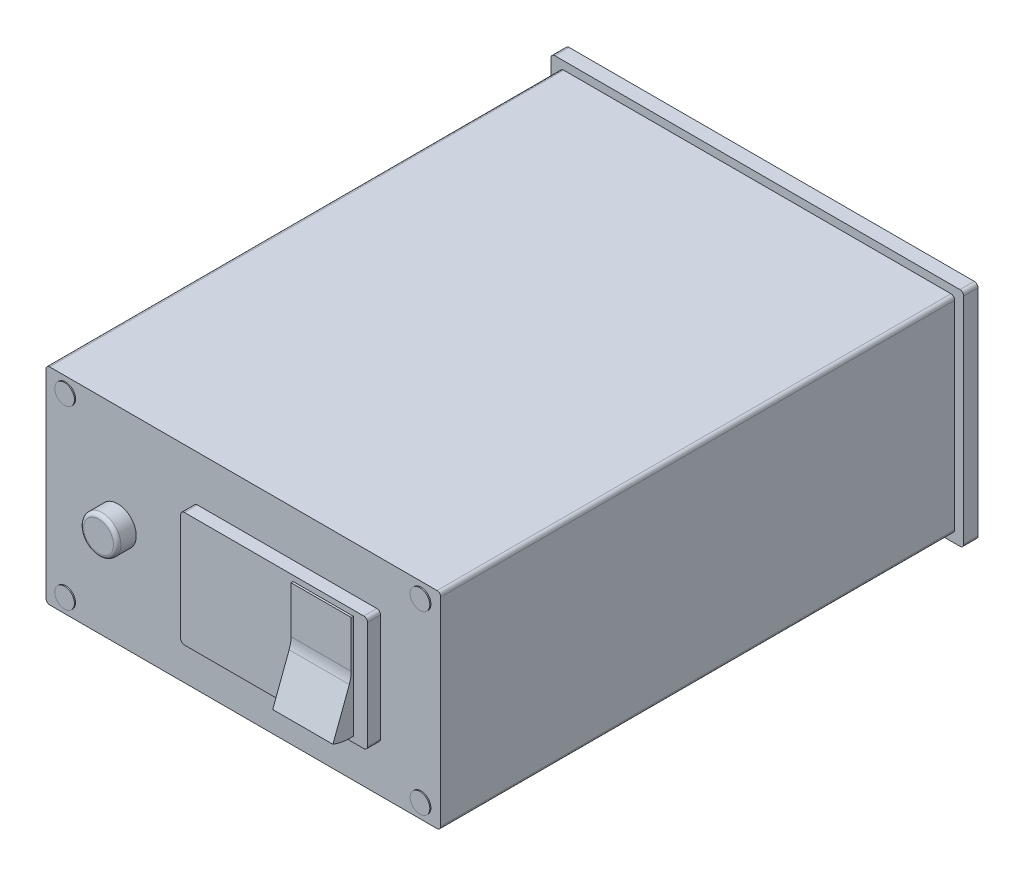
from build123d import *

# Parameters (mm, degrees)
SKETCH1_W               = 111.06
SKETCH1_H               = 59.85
FACE_2_DEPTH            = 3.86
FACE_FILLETS_R          = 1
SKETCH2_W               = 106.25
SKETCH2_H               = 55.5
BODY_DEPTH              = 142.2
SKETCH3_W               = 12.75
SKETCH3_H               = 12.75
FEET_DEPTH              = 3.33
FEET_DRAFT              = 25
FEET_PROFILE_2_DEPTH    = 3.33
FEET_PROFILE_2_DRAFT    = 25
FEET_PROFILE_3_DEPTH    = 3.33
FEET_PROFILE_3_DRAFT    = 25
FEET_PROFILE_4_DEPTH    = 3.33
FEET_PROFILE_4_DRAFT    = 25
BODY_FILLETS_R          = 1
SKETCH4_R               = 5
GND_BANNANA_PORT_DEPTH  = 5.15
FILLET3_R               = 1
SKETCH5_W               = 50.3
SKETCH5_H               = 30.9
POWER_PORT_DEPTH        = 3.5
FILLET4_R               = 1
BOSS_EXTRUDE6_DEPTH     = 8.1
SKETCH7_R               = 6.5
BOSS_EXTRUDE7_DEPTH     = 2.35
SKETCH8_R               = 2.65
BOSS_EXTRUDE8_DEPTH     = 0.3
MIRROR2_COPY_1_SKETCH_R = 2.65
MIRROR2_COPY_1_DEPTH    = 0.3
MIRROR2_COPY_2_SKETCH_R = 2.65
MIRROR2_COPY_2_DEPTH    = 0.3


with BuildPart() as part:
    # Sketch1 → Face 2 (new body)
    with BuildSketch(Plane.XY):
        Rectangle(SKETCH1_W, SKETCH1_H)
    extrude(amount=FACE_2_DEPTH)

    # Face Fillets
    face_fillets_edges = [part.edges().sort_by_distance(p)[0] for p in [
        (-55.53, 29.925, 1.93),
        (-55.53, -29.925, 1.93),
        (55.53, -29.925, 1.93),
        (55.53, 29.925, 1.93),
    ]]
    fillet(face_fillets_edges, radius=FACE_FILLETS_R)

    # Sketch2 → Body (add)
    with BuildSketch(Plane.XY):
        Rectangle(SKETCH2_W, SKETCH2_H)
    extrude(amount=BODY_DEPTH)


with BuildPart() as feet_tool:
    # Sketch3 → Feet (with draft: the straight prism first)
    with BuildSketch(Plane.XZ.offset(27.75)):
        with Locations((-36.625, 123.95)):
            Rectangle(SKETCH3_W, SKETCH3_H)
    extrude(amount=FEET_DEPTH)
    # Feet: the draft: its side faces are tilted about the plane it starts from
    feet_sides = [feet_tool.faces().sort_by_distance(p)[0] for p in [
        (-36.625, -29.415, 117.575),
        (-30.25, -29.415, 123.95),
        (-36.625, -29.415, 130.325),
        (-43, -29.415, 123.95),
    ]]
    draft(feet_sides, Plane.XZ.offset(27.75), FEET_DRAFT)


with BuildPart() as part_1:
    add(part.part)

    # Feet: add feet_tool
    add(feet_tool.part)


with BuildPart() as feet_profile_2_tool:
    # Sketch3 → Feet profile 2 (with draft: the straight prism first)
    with BuildSketch(Plane.XZ.offset(27.75)):
        with Locations((36.625, 123.95)):
            Rectangle(SKETCH3_W, SKETCH3_H)
    extrude(amount=FEET_PROFILE_2_DEPTH)
    # Feet profile 2: the draft: its side faces are tilted about the plane it starts from
    feet_profile_2_sides = [feet_profile_2_tool.faces().sort_by_distance(p)[0] for p in [
        (36.625, -29.415, 117.575),
        (43, -29.415, 123.95),
        (36.625, -29.415, 130.325),
        (30.25, -29.415, 123.95),
    ]]
    draft(feet_profile_2_sides, Plane.XZ.offset(27.75), FEET_PROFILE_2_DRAFT)


with BuildPart() as part_2:
    add(part_1.part)

    # Feet profile 2: add feet_profile_2_tool
    add(feet_profile_2_tool.part)


with BuildPart() as feet_profile_3_tool:
    # Sketch3 → Feet profile 3 (with draft: the straight prism first)
    with BuildSketch(Plane.XZ.offset(27.75)):
        with Locations((36.625, 18.86)):
            Rectangle(SKETCH3_W, SKETCH3_H)
    extrude(amount=FEET_PROFILE_3_DEPTH)
    # Feet profile 3: the draft: its side faces are tilted about the plane it starts from
    feet_profile_3_sides = [feet_profile_3_tool.faces().sort_by_distance(p)[0] for p in [
        (36.625, -29.415, 12.485),
        (43, -29.415, 18.86),
        (36.625, -29.415, 25.235),
        (30.25, -29.415, 18.86),
    ]]
    draft(feet_profile_3_sides, Plane.XZ.offset(27.75), FEET_PROFILE_3_DRAFT)


with BuildPart() as part_3:
    add(part_2.part)

    # Feet profile 3: add feet_profile_3_tool
    add(feet_profile_3_tool.part)


with BuildPart() as feet_profile_4_tool:
    # Sketch3 → Feet profile 4 (with draft: the straight prism first)
    with BuildSketch(Plane.XZ.offset(27.75)):
        with Locations((-36.625, 18.86)):
            Rectangle(SKETCH3_W, SKETCH3_H)
    extrude(amount=FEET_PROFILE_4_DEPTH)
    # Feet profile 4: the draft: its side faces are tilted about the plane it starts from
    feet_profile_4_sides = [feet_profile_4_tool.faces().sort_by_distance(p)[0] for p in [
        (-36.625, -29.415, 12.485),
        (-30.25, -29.415, 18.86),
        (-36.625, -29.415, 25.235),
        (-43, -29.415, 18.86),
    ]]
    draft(feet_profile_4_sides, Plane.XZ.offset(27.75), FEET_PROFILE_4_DRAFT)


with BuildPart() as part_4:
    add(part_3.part)

    # Feet profile 4: add feet_profile_4_tool
    add(feet_profile_4_tool.part)

    # Body Fillets
    body_fillets_edges = [part_4.edges().sort_by_distance(p)[0] for p in [
        (53.125, 27.75, 73.03),
        (53.125, -27.75, 73.03),
        (-53.125, -27.75, 73.03),
        (-53.125, 27.75, 73.03),
    ]]
    fillet(body_fillets_edges, radius=BODY_FILLETS_R)

    # Sketch4 → GND Bannana Port (add)
    with BuildSketch(Plane.XY.offset(142.2)):
        with Locations((-33.825, 0)):
            Circle(SKETCH4_R)
    extrude(amount=GND_BANNANA_PORT_DEPTH)

    # Fillet3
    fillet3_edges = [part_4.edges().sort_by_distance(p)[0] for p in [
        (-38.825, 0, 147.35),
    ]]
    fillet(fillet3_edges, radius=FILLET3_R)

    # Sketch5 → Power Port (add)
    with BuildSketch(Plane.XY.offset(142.2)):
        with Locations((11.775, 0)):
            Rectangle(SKETCH5_W, SKETCH5_H)
    extrude(amount=POWER_PORT_DEPTH)

    # Fillet4
    fillet4_edges = [part_4.edges().sort_by_distance(p)[0] for p in [
        (-13.375, 15.45, 143.95),
        (-13.375, -15.45, 143.95),
        (36.925, -15.45, 143.95),
        (36.925, 15.45, 143.95),
    ]]
    fillet(fillet4_edges, radius=FILLET4_R)

    # Sketch6 → Boss-Extrude6 (add, symmetric)
    with BuildSketch(Plane(origin=(25, 0, 0), x_dir=(0, 0, -1), z_dir=(1, 0, 0))):
        with BuildLine():
            Line((-146.274020994, 13.999996995), (-146.274020994, 1.432465982))
            ThreePointArc((-146.274020994, 1.432465982), (-146.403313198, 0), (-146.787010691, -1.386164311))
            Line((-146.787010691, -1.386164311), (-151.2, -13.108204089))
            ThreePointArc((-151.2, -13.108204089), (-132.50876584, -2.503026356), (-146.274020994, 13.999996995))
        make_face()
    extrude(amount=BOSS_EXTRUDE6_DEPTH, both=True)

    # Sketch7 → Boss-Extrude7 (add, symmetric)
    with BuildSketch(Plane(origin=(0, 0, 0), x_dir=(-1, 0, 0), z_dir=(0, 0, -1))):
        with Locations((-34.53, -2.925)):
            Circle(SKETCH7_R)
    extrude(amount=BOSS_EXTRUDE7_DEPTH, both=True)

    # Sketch8 → Boss-Extrude8 (add, symmetric)
    with BuildSketch(Plane.XY.offset(142.2)):
        with Locations((-47.825, 23.75)):
            Circle(SKETCH8_R)
    boss_extrude8 = extrude(amount=BOSS_EXTRUDE8_DEPTH, both=True)

    # Mirror1: Boss-Extrude8 across plane
    add(boss_extrude8.mirror(Plane(origin=(0, 0, 0), x_dir=(0, 0, 1), z_dir=(1, 0, 0))))

    # Mirror2 copy 1 sketch → Mirror2 copy 1 (add, symmetric)
    with BuildSketch(Plane(origin=(0, 0, 142.2), x_dir=(-1, 0, 0), z_dir=(0, 0, 1))):
        with Locations((-47.825, 23.75)):
            Circle(MIRROR2_COPY_1_SKETCH_R)
    extrude(amount=MIRROR2_COPY_1_DEPTH, both=True)

    # Mirror2 copy 2 sketch → Mirror2 copy 2 (add, symmetric)
    with BuildSketch(Plane.XY.offset(142.2)):
        with Locations((-47.825, -23.75)):
            Circle(MIRROR2_COPY_2_SKETCH_R)
    extrude(amount=MIRROR2_COPY_2_DEPTH, both=True)


solid = part_4.part
